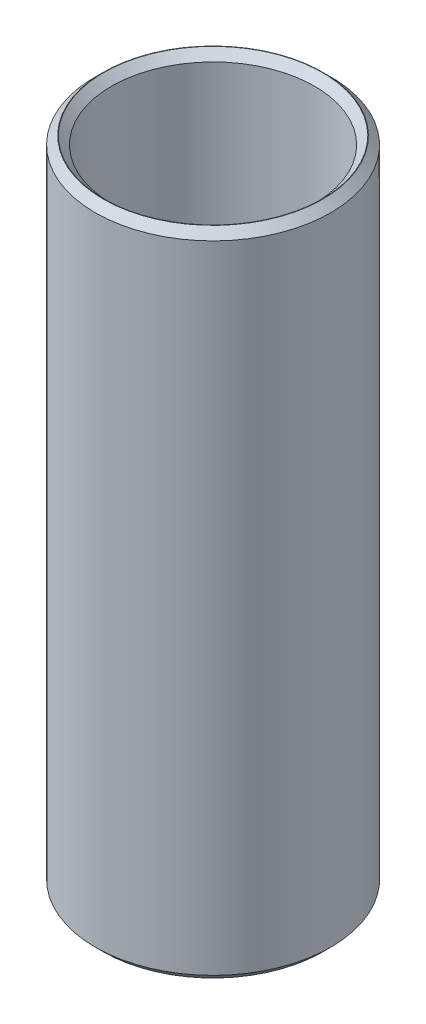
from build123d import *

# Parameters (mm, degrees)
SKETCH1_R           = 37.5
BOSS_EXTRUDE1_DEPTH = 207.606304188
SKETCH2_R           = 32.339670157
CUT_EXTRUDE1_DEPTH  = 215.27290435
CHAMFER1_SIZE       = 2.51328974


with BuildPart() as part:
    # Sketch1 → Boss-Extrude1 (new body)
    with BuildSketch(Plane(origin=(0, 0, 0), x_dir=(1, 0, 0), z_dir=(0, 1, 0))):
        Circle(SKETCH1_R)
    extrude(amount=BOSS_EXTRUDE1_DEPTH)

    # Sketch2 → Cut-Extrude1 (cut, through all)
    with BuildSketch(Plane(origin=(0, 0, 0), x_dir=(1, 0, 0), z_dir=(0, 1, 0))):
        Circle(SKETCH2_R)
    extrude(amount=CUT_EXTRUDE1_DEPTH, mode=Mode.SUBTRACT)

    # Chamfer1
    chamfer1_edges = [part.edges().sort_by_distance(p)[0] for p in [
        (-32.339670157, 207.606304188, 0),
        (-32.339670157, 0, 0),
        (-37.5, 0, 0),
        (-37.5, 207.606304188, 0),
    ]]
    chamfer(chamfer1_edges, length=CHAMFER1_SIZE)


solid = part.part
